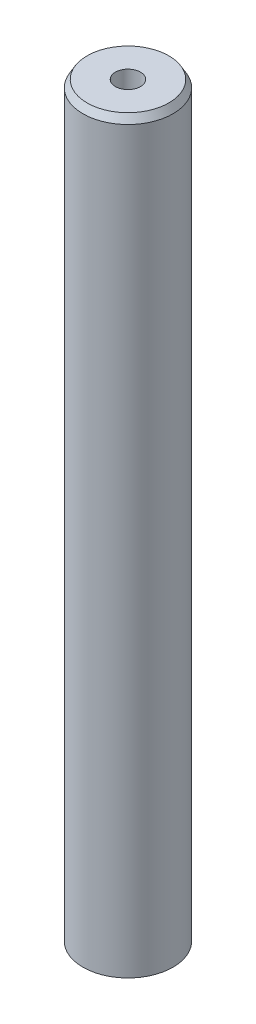
from build123d import *
from OCP.BRepFilletAPI import BRepFilletAPI_MakeChamfer

# Parameters (mm, degrees)
SKETCH1_R           = 7.5
BOSS_EXTRUDE1_DEPTH = 124.926275474
SKETCH2_R           = 2.090123894
CUT_EXTRUDE1_DEPTH  = 126.375732516
CHAMFER1_SIZE       = 1.211511381
CHAMFER1_SIZE2      = 0.699466422


with BuildPart() as part:
    # Sketch1 → Boss-Extrude1 (new body)
    with BuildSketch(Plane(origin=(0, 0, 0), x_dir=(1, 0, 0), z_dir=(0, 1, 0))):
        Circle(SKETCH1_R)
    extrude(amount=BOSS_EXTRUDE1_DEPTH)

    # Sketch2 → Cut-Extrude1 (cut, through all)
    with BuildSketch(Plane(origin=(0, 0, 0), x_dir=(1, 0, 0), z_dir=(0, 1, 0))):
        Circle(SKETCH2_R)
    extrude(amount=CUT_EXTRUDE1_DEPTH, mode=Mode.SUBTRACT)

    # Chamfer1: one chamfer whose edges measure the first distance from different faces: ONE call of the kernel's chamfer builder (chamfer() names one face for all edges)
    chamfer1_edges_1 = [part.edges().sort_by_distance(p)[0] for p in [
        (-7.5, 124.926275474, 0),
    ]]
    chamfer1_side_1 = [part.faces().sort_by_distance(p)[0] for p in [
        (-7.5, 62.463137737, 0),
    ]]
    chamfer1_edges_2 = [part.edges().sort_by_distance(p)[0] for p in [
        (-7.5, 0, 0),
    ]]
    chamfer1_side_2 = [part.faces().sort_by_distance(p)[0] for p in [
        (-7.287867966, 0, 0),
    ]]
    chamfer1 = BRepFilletAPI_MakeChamfer(part.part.solid().wrapped)
    for e in chamfer1_edges_1:
        chamfer1.Add(CHAMFER1_SIZE, CHAMFER1_SIZE2, e.wrapped, chamfer1_side_1[0].wrapped)  # the first distance lies on this face
    for e in chamfer1_edges_2:
        chamfer1.Add(CHAMFER1_SIZE, CHAMFER1_SIZE2, e.wrapped, chamfer1_side_2[0].wrapped)  # the first distance lies on this face
    add(Compound.cast(chamfer1.Shape()), mode=Mode.REPLACE)


solid = part.part
